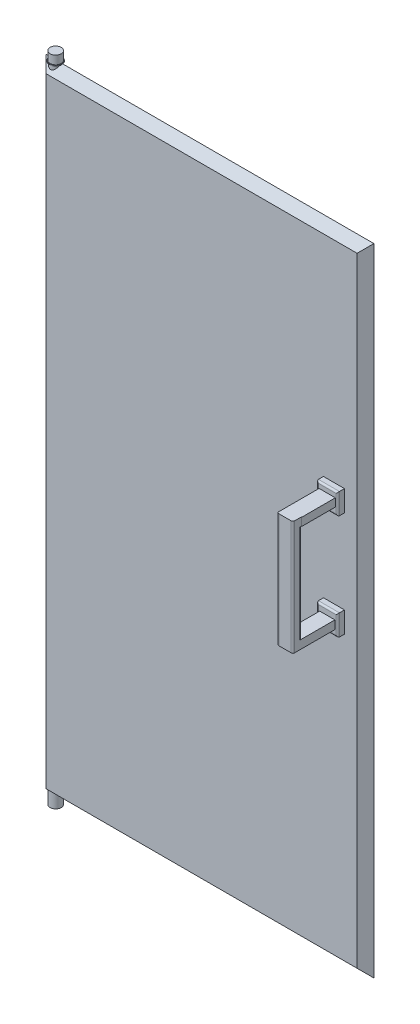
from build123d import *

# Parameters (mm, degrees)
SKETCH1_W            = 390
SKETCH1_H            = 756.8
BOSS_EXTRUDE1_DEPTH  = 20
SKETCH2_R            = 6.05
BOSS_EXTRUDE2_DEPTH  = 10
SKETCH3_R            = 6.631048811
BOSS_EXTRUDE3_DEPTH  = 10
CHAMFER1_SIZE        = 10
BOSS_EXTRUDE5_DEPTH  = 50
SKETCH5_W            = 30
SKETCH5_H            = 160
CUT_EXTRUDE1_DEPTH   = 50
CHAMFER2_SIZE        = 10
CUT_EXTRUDE2_DEPTH   = 121
SKETCH10_W           = 25
SKETCH10_H           = 25
BOSS_EXTRUDE7_DEPTH  = 8
SKETCH15_W           = 19.321199796
SKETCH15_H           = 9.52453511
BOSS_EXTRUDE8_DEPTH  = 40
SKETCH16_W           = 18.085272723
SKETCH16_H           = 9.99449282
BOSS_EXTRUDE9_DEPTH  = 40
SKETCH18_W           = 18.812893718
SKETCH18_H           = 136.043392328
BOSS_EXTRUDE10_DEPTH = 10
FILLET1_R            = 2
FILLET2_R            = 2
FILLET3_R            = 2
CUT_EXTRUDE3_START   = -10
SKETCH23_R           = 6.05
CUT_EXTRUDE3_DEPTH   = 10
SKETCH24_R           = 7.299940413
BOSS_EXTRUDE11_DEPTH = 1
BOSS_EXTRUDE12_START = 10
SKETCH27_R           = 6.63104881
BOSS_EXTRUDE12_DEPTH = 10


with BuildPart() as part:
    # Sketch1 → Boss-Extrude1 (new body)
    with BuildSketch(Plane.XY):
        with Locations((154.409313495, -346.327898551)):
            Rectangle(SKETCH1_W, SKETCH1_H)
    extrude(amount=BOSS_EXTRUDE1_DEPTH)

    # Sketch2 → Boss-Extrude2 (add)
    with BuildSketch(Plane(origin=(0, 32.072101449, 0), x_dir=(1, 0, 0), z_dir=(0, 1, 0))):
        with Locations(Location((-28.78378628, -10.435138004, 0), (0, 0, 90))):
            Circle(SKETCH2_R)
    extrude(amount=BOSS_EXTRUDE2_DEPTH)

    # Sketch3 → Boss-Extrude3 (add)
    with BuildSketch(Plane.XZ.offset(724.727898551)):
        with Locations(Location((-28.78378628, 10.435138004, 0), (0, 0, 90))):
            Circle(SKETCH3_R)
    extrude(amount=BOSS_EXTRUDE3_DEPTH)

    # Chamfer1
    # the kernel refuses this chamfer: 10 mm, written as the material it takes off along each edge
    with BuildSketch(Plane(origin=(-40.590686505, -750.44472843, 20), x_dir=(-0.027495876610586317, 0, -0.9996219169112968), z_dir=(0, 1, 0)), Plane(origin=(349.409313495, 57.788931329, 0), x_dir=(-0.9996219169112968, 0, -0.027495876610586334), z_dir=(0, -1, 0))) as chamfer1_piece_1:
        Polygon((CHAMFER1_SIZE * 0.999621916911, -CHAMFER1_SIZE * 0.0274958766106), (-CHAMFER1_SIZE * 0.0274958766106, -CHAMFER1_SIZE * 0.999621916911), (0, 0), align=None)
    extrude(amount=808.233659759, mode=Mode.SUBTRACT)
    with BuildSketch(Plane(origin=(375.126143374, -724.727898551, 20), x_dir=(0, 0.9996219169112968, 0.02749587661058643), z_dir=(-1, 0, 0))) as chamfer1_piece_2_section:
        Polygon((CHAMFER1_SIZE * 0.999621916911, CHAMFER1_SIZE * 0.0274958766106), (-CHAMFER1_SIZE * 0.0274958766106, CHAMFER1_SIZE * 0.999621916911), (0, 0), align=None)
    chamfer1_piece_2 = extrude(amount=441.433659759, mode=Mode.PRIVATE)
    chamfer1_piece_2 = chamfer1_piece_2 - Plane(origin=(-28.78378628, -721.415314621, 10.435138004), x_dir=(0, 0, 1), z_dir=(0, 1, 0)) * Cylinder(6.631048811, 923, mode=Mode.PRIVATE)
    add(chamfer1_piece_2, mode=Mode.SUBTRACT)
    with BuildSketch(Plane(origin=(349.409313495, 57.788931329, 20), x_dir=(-0.9996219169112968, 0, 0.027495876610586282), z_dir=(0, -1, 0)), Plane(origin=(-40.590686505, -750.44472843, 0), x_dir=(-0.027495876610586317, 0, 0.9996219169112968), z_dir=(0, 1, 0))) as chamfer1_piece_3:
        Polygon((CHAMFER1_SIZE * 0.999621916911, CHAMFER1_SIZE * 0.0274958766106), (-CHAMFER1_SIZE * 0.0274958766106, CHAMFER1_SIZE * 0.999621916911), (0, 0), align=None)
    extrude(amount=808.233659759, mode=Mode.SUBTRACT)
    with BuildSketch(Plane(origin=(-66.307516385, 32.072101449, 20), x_dir=(0, 0.027495876610586317, -0.9996219169112968), z_dir=(1, 0, 0))) as chamfer1_piece_4_section:
        Polygon((CHAMFER1_SIZE * 0.999621916911, -CHAMFER1_SIZE * 0.0274958766106), (-CHAMFER1_SIZE * 0.0274958766106, -CHAMFER1_SIZE * 0.999621916911), (0, 0), align=None)
    chamfer1_piece_4 = extrude(amount=441.433659759, mode=Mode.PRIVATE)
    chamfer1_piece_4 = chamfer1_piece_4 - Plane(origin=(-28.78378628, 28.76135635, 10.435138004), x_dir=(0, 0, -1), z_dir=(0, -1, 0)) * Cylinder(6.05, 923, mode=Mode.PRIVATE)
    add(chamfer1_piece_4, mode=Mode.SUBTRACT)
    with BuildSketch(Plane(origin=(375.126143374, -724.727898551, 0), x_dir=(0, 0.9996219169112968, -0.027495876610586487), z_dir=(-1, 0, 0))) as chamfer1_piece_5_section:
        Polygon((CHAMFER1_SIZE * 0.999621916911, -CHAMFER1_SIZE * 0.0274958766106), (-CHAMFER1_SIZE * 0.0274958766106, -CHAMFER1_SIZE * 0.999621916911), (0, 0), align=None)
    chamfer1_piece_5 = extrude(amount=441.433659759, mode=Mode.PRIVATE)
    chamfer1_piece_5 = chamfer1_piece_5 - Plane(origin=(-28.78378628, -721.416873801, 10.435138004), x_dir=(0, 0, 1), z_dir=(0, 1, 0)) * Cylinder(6.631048811, 923, mode=Mode.PRIVATE)
    add(chamfer1_piece_5, mode=Mode.SUBTRACT)
    with BuildSketch(Plane(origin=(-66.307516385, 32.072101449, 0), x_dir=(0, 0.027495876610586317, 0.9996219169112968), z_dir=(1, 0, 0))) as chamfer1_piece_6_section:
        Polygon((CHAMFER1_SIZE * 0.999621916911, CHAMFER1_SIZE * 0.0274958766106), (-CHAMFER1_SIZE * 0.0274958766106, CHAMFER1_SIZE * 0.999621916911), (0, 0), align=None)
    chamfer1_piece_6 = extrude(amount=441.433659759, mode=Mode.PRIVATE)
    chamfer1_piece_6 = chamfer1_piece_6 - Plane(origin=(-28.78378628, 28.763199232, 10.435138004), x_dir=(0, 0, -1), z_dir=(0, -1, 0)) * Cylinder(6.05, 923, mode=Mode.PRIVATE)
    add(chamfer1_piece_6, mode=Mode.SUBTRACT)

    # Sketch4 → Boss-Extrude5 (add)
    with BuildSketch(Plane.XY.offset(20)):
        Polygon((309.409313495, -346.327898551), (309.409313495, -246.327898551), (339.409313495, -246.327898551), (339.409313495, -446.327898551), (309.409313495, -446.327898551), align=None)
    extrude(amount=BOSS_EXTRUDE5_DEPTH)

    # Sketch5 → Cut-Extrude1 (cut)
    with BuildSketch(Plane(origin=(339.409313495, 0, 0), x_dir=(0, 0, -1), z_dir=(1, 0, 0))):
        with Locations((-35, -346.327898551)):
            Rectangle(SKETCH5_W, SKETCH5_H)
    extrude(amount=-CUT_EXTRUDE1_DEPTH, mode=Mode.SUBTRACT)

    # Chamfer2
    chamfer2_edges = [part.edges().sort_by_distance(p)[0] for p in [
        (309.409313495, -346.327898551, 70),
        (309.409313495, -246.327898551, 45),
        (324.409313495, -446.327898551, 70),
        (309.409313495, -446.327898551, 45),
        (339.409313495, -446.327898551, 45),
        (324.409313495, -246.327898551, 70),
        (339.409313495, -246.327898551, 45),
        (339.409313495, -346.327898551, 70),
    ]]
    chamfer(chamfer2_edges, length=CHAMFER2_SIZE)

    # Sketch7 → Cut-Extrude2 (cut)
    with BuildSketch(Plane.XY.offset(20)):
        Polygon((309.409313495, -256.327898551), (319.409313495, -246.327898551), (329.409313495, -246.327898551), (339.409313495, -256.327898551), (339.409313495, -436.327898551), (329.409313495, -446.327898551), (319.409313495, -446.327898551), (309.409313495, -436.327898551), align=None)
    extrude(amount=CUT_EXTRUDE2_DEPTH, mode=Mode.SUBTRACT)

    # Sketch10 → Boss-Extrude7 (add)
    with BuildSketch(Plane.XY.offset(20)):
        with Locations((311.909313495, -240.427898551)):
            Rectangle(SKETCH10_W, SKETCH10_H)
        with Locations((311.909313495, -365.427898551)):
            Rectangle(SKETCH10_W, SKETCH10_H)
    extrude(amount=BOSS_EXTRUDE7_DEPTH)

    # Sketch15 → Boss-Extrude8 (add)
    with BuildSketch(Plane.XY.offset(28)):
        with Locations((311.88508976, -239.60936129)):
            Rectangle(SKETCH15_W, SKETCH15_H)
    extrude(amount=BOSS_EXTRUDE8_DEPTH)

    # Sketch16 → Boss-Extrude9 (add)
    with BuildSketch(Plane.XY.offset(28)):
        with Locations((311.994747219, -365.893239653)):
            Rectangle(SKETCH16_W, SKETCH16_H)
    extrude(amount=BOSS_EXTRUDE9_DEPTH)

    # Sketch18 → Boss-Extrude10 (add)
    with BuildSketch(Plane.XY.offset(68)):
        with Locations((311.630936721, -302.868789899)):
            Rectangle(SKETCH18_W, SKETCH18_H)
    extrude(amount=BOSS_EXTRUDE10_DEPTH)

    # Fillet1
    fillet1_edges = [part.edges().sort_by_distance(p)[0] for p in [
        (302.224489862, -307.631057454, 68),
        (321.03738358, -302.633811044, 68),
        (321.03738358, -302.868789899, 78),
        (302.224489862, -302.868789899, 78),
    ]]
    fillet(fillet1_edges, radius=FILLET1_R)

    # Fillet2
    fillet2_edges = [part.edges().sort_by_distance(p)[0] for p in [
        (299.409313495, -240.427898551, 28),
        (311.909313495, -252.927898551, 28),
        (324.409313495, -240.427898551, 28),
        (311.909313495, -227.927898551, 28),
    ]]
    fillet(fillet2_edges, radius=FILLET2_R)

    # Fillet3
    fillet3_edges = [part.edges().sort_by_distance(p)[0] for p in [
        (299.409313495, -365.427898551, 28),
        (311.909313495, -377.927898551, 28),
        (324.409313495, -365.427898551, 28),
        (311.909313495, -352.927898551, 28),
    ]]
    fillet(fillet3_edges, radius=FILLET3_R)

    # Sketch23 → Cut-Extrude3 (cut)
    with BuildSketch(Plane(origin=(0, 42.072101449, 0), x_dir=(1, 0, 0), z_dir=(0, 1, 0)).offset(CUT_EXTRUDE3_START)):
        with Locations((-28.78378628, -10.435138004)):
            Circle(SKETCH23_R)
    extrude(amount=CUT_EXTRUDE3_DEPTH, mode=Mode.SUBTRACT)

    # Sketch24 → Boss-Extrude11 (add)
    with BuildSketch(Plane(origin=(0, 32.072101449, 0), x_dir=(1, 0, 0), z_dir=(0, 1, 0))):
        with Locations((-28.78378628, -10.435138004)):
            Circle(SKETCH24_R)
    extrude(amount=-BOSS_EXTRUDE11_DEPTH)

    # Sketch27 → Boss-Extrude12 (add)
    with BuildSketch(Plane(origin=(0, 32.072101449, 0), x_dir=(1, 0, 0), z_dir=(0, 1, 0)).offset(BOSS_EXTRUDE12_START)):
        with Locations(Location((-28.78378628, -10.435138004, 0), (0, 0, 3.762526837))):
            Circle(SKETCH27_R)
    extrude(amount=-BOSS_EXTRUDE12_DEPTH)


solid = part.part
